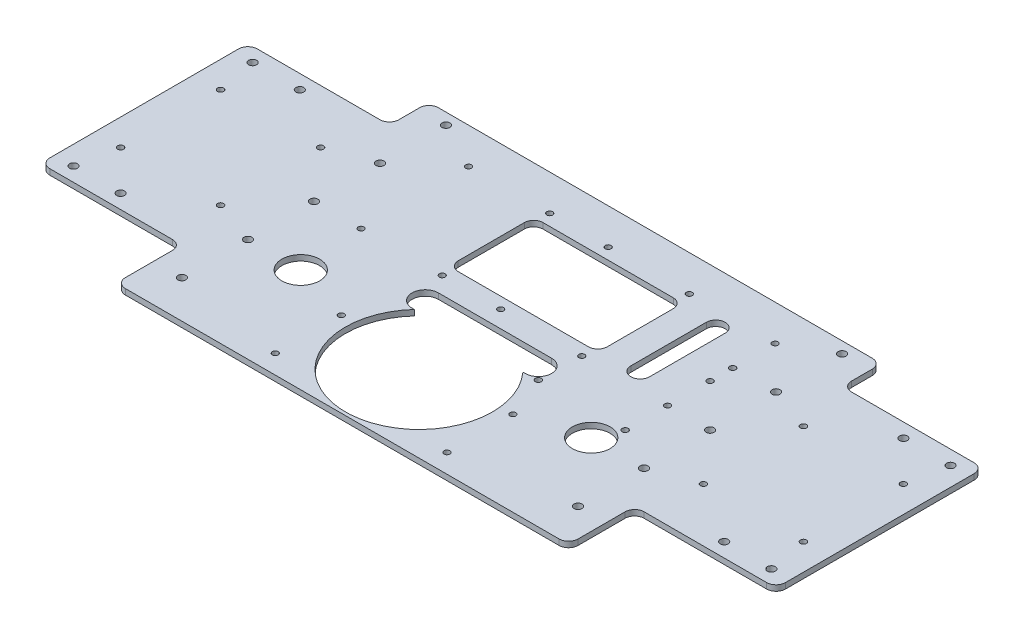
from build123d import *

# Parameters (mm, degrees)
SKETCH_1_W          = 240
SKETCH_1_H          = 166
EXTRUDE_1272_DEPTH  = 3
SKETCH_4_R          = 2.1
SKETCH_4_R_2        = 1.55
CUT_EXTRUDE_3_DEPTH = 251.068459046
SKETCH_5_R          = 1.55
SKETCH_5_R_2        = 10
SKETCH_5_W          = 79
SKETCH_5_H          = 45
CUT_EXTRUDE_4_DEPTH = 251.068459046
SKETCH_6_W          = 75
SKETCH_6_H          = 110
SKETCH_6_R          = 2.1
EXTRUDE_1_DEPTH     = 3
FILLET_1_R          = 5
SKETCH_8_R          = 39
CUT_EXTRUDE_6_DEPTH = 10
CUT_EXTRUDE_START   = -10
SKETCH_9_R          = 1.55
SKETCH_9_R_2        = 1.6
CUT_EXTRUDE_7_DEPTH = 10
SKETCH_10_R         = 1.6
CUT_EXTRUDE_8_DEPTH = 10


with BuildPart() as part:
    # 草图1 → Extrude 1272 (new body)
    with BuildSketch(Plane(origin=(0, 0, 0), x_dir=(1, 0, 0), z_dir=(0, 1, 0))):
        with Locations((31.575924772, -115.871750732)):
            Rectangle(SKETCH_1_W, SKETCH_1_H)
    extrude(amount=EXTRUDE_1272_DEPTH)

    # 草图4 → 切除-拉伸3 (cut, through all)
    with BuildSketch(Plane(origin=(0, 3, 0), x_dir=(1, 0, 0), z_dir=(0, 1, 0))):
        with Locations((-73.424075228, -73.871750732)):
            Circle(SKETCH_4_R)
        with Locations((136.575924772, -178.871750732)):
            Circle(SKETCH_4_R)
        with Locations((-73.424075228, -108.871750732)):
            Circle(SKETCH_4_R)
        with Locations((-73.424075228, -143.871750732)):
            Circle(SKETCH_4_R)
        with Locations((-73.424075228, -178.871750732)):
            Circle(SKETCH_4_R)
        with Locations((136.575924772, -143.871750732)):
            Circle(SKETCH_4_R)
        with Locations((136.575924772, -108.871750732)):
            Circle(SKETCH_4_R)
        with Locations((136.575924772, -73.871750732)):
            Circle(SKETCH_4_R)
        with Locations((-73.424075228, -38.871750732)):
            Circle(SKETCH_4_R)
        with Locations((136.575924772, -38.871750732)):
            Circle(SKETCH_4_R)
        with Locations((77.075924772, -188.871750732)):
            Circle(SKETCH_4_R_2)
        with Locations((-13.924075228, -188.871750732)):
            Circle(SKETCH_4_R_2)
        with Locations((77.075924772, -153.871750732)):
            Circle(SKETCH_4_R_2)
        with Locations((-13.924075228, -153.871750732)):
            Circle(SKETCH_4_R_2)
    extrude(amount=-CUT_EXTRUDE_3_DEPTH, mode=Mode.SUBTRACT)

    # 草图5 → 切除-拉伸4 (cut, through all)
    with BuildSketch(Plane(origin=(0, 3, 0), x_dir=(1, 0, 0), z_dir=(0, 1, 0))):
        with Locations((-5.424075228, -51.871750732)):
            Circle(SKETCH_5_R)
        with Locations((68.575924772, -51.871750732)):
            Circle(SKETCH_5_R)
        with Locations((68.575924772, -108.871750732)):
            Circle(SKETCH_5_R)
        with Locations((-5.424075228, -108.871750732)):
            Circle(SKETCH_5_R)
        with Locations((-45.424075228, -143.871750732)):
            Circle(SKETCH_5_R_2)
        with Locations((108.575924772, -143.871750732)):
            Circle(SKETCH_5_R_2)
        with Locations((31.575924772, -80.371750732)):
            Rectangle(SKETCH_5_W, SKETCH_5_H)
        with BuildLine():
            Line((86.075924772, -100.371750732), (86.075924772, -60.371750732))
            ThreePointArc((86.075924772, -60.371750732), (91.075924772, -55.371750732), (96.075924772, -60.371750732))
            Line((96.075924772, -60.371750732), (96.075924772, -100.371750732))
            ThreePointArc((96.075924772, -100.371750732), (91.075924772, -105.371750732), (86.075924772, -100.371750732))
        make_face()
        with BuildLine():
            Line((1.575924772, -117.871750732), (61.575924772, -117.871750732))
            ThreePointArc((61.575924772, -117.871750732), (68.575924772, -124.871750732), (61.575924772, -131.871750732))
            Line((61.575924772, -131.871750732), (41.575924772, -131.871750732))
            ThreePointArc((41.575924772, -131.871750732), (31.575924772, -141.871750732), (21.575924772, -131.871750732))
            Line((21.575924772, -131.871750732), (1.575924772, -131.871750732))
            ThreePointArc((1.575924772, -131.871750732), (-5.424075228, -124.871750732), (1.575924772, -117.871750732))
        make_face()
    extrude(amount=-CUT_EXTRUDE_4_DEPTH, mode=Mode.SUBTRACT)

    # 草图6 → 凸台-拉伸1 (add)
    # profile 1 of 2: a face of its own
    with BuildSketch(Plane(origin=(0, 0, 0), x_dir=(1, 0, 0), z_dir=(0, 1, 0))):
        with Locations((-125.924075228, -108.871750732)):
            Rectangle(SKETCH_6_W, SKETCH_6_H)
        with Locations((-153.424075228, -61.371750732)):
            Circle(SKETCH_6_R, mode=Mode.SUBTRACT)
        with Locations((-153.424075228, -156.371750732)):
            Circle(SKETCH_6_R, mode=Mode.SUBTRACT)
        with Locations((-128.424075228, -61.371750732)):
            Circle(SKETCH_6_R, mode=Mode.SUBTRACT)
        with Locations((-128.424075228, -156.371750732)):
            Circle(SKETCH_6_R, mode=Mode.SUBTRACT)
    # profile 2 of 2: a face of its own
    with BuildSketch(Plane(origin=(0, 0, 0), x_dir=(1, 0, 0), z_dir=(0, 1, 0))):
        with Locations((189.075924772, -108.871750732)):
            Rectangle(SKETCH_6_W, SKETCH_6_H)
        with Locations((216.575924772, -156.371750732)):
            Circle(SKETCH_6_R, mode=Mode.SUBTRACT)
        with Locations((216.575924772, -61.371750732)):
            Circle(SKETCH_6_R, mode=Mode.SUBTRACT)
        with Locations((191.575924772, -156.371750732)):
            Circle(SKETCH_6_R, mode=Mode.SUBTRACT)
        with Locations((191.575924772, -61.371750732)):
            Circle(SKETCH_6_R, mode=Mode.SUBTRACT)
    extrude(amount=EXTRUDE_1_DEPTH)

    # 圆角1
    fillet_1_edges = [part.edges().sort_by_distance(p)[0] for p in [
        (71.075924772, 1.5, 102.871750732),
        (-7.924075228, 1.5, 102.871750732),
        (-7.924075228, 1.5, 57.871750732),
        (71.075924772, 1.5, 57.871750732),
        (151.575924772, 1.5, 32.871750732),
        (-88.424075228, 1.5, 32.871750732),
        (151.575924772, 1.5, 53.871750732),
        (151.575924772, 1.5, 163.871750732),
        (-88.424075228, 1.5, 163.871750732),
        (-88.424075228, 1.5, 53.871750732),
        (226.575924772, 1.5, 53.871750732),
        (226.575924772, 1.5, 163.871750732),
        (151.575924772, 1.5, 198.871750732),
        (-88.424075228, 1.5, 198.871750732),
        (-163.424075228, 1.5, 53.871750732),
        (-163.424075228, 1.5, 163.871750732),
        (41.575924772, 1.5, 131.871750732),
        (21.575924772, 1.5, 131.871750732),
    ]]
    fillet(fillet_1_edges, radius=FILLET_1_R)

    # 草图8 → 切除-拉伸6 (cut)
    with BuildSketch(Plane(origin=(0, 3, 0), x_dir=(1, 0, 0), z_dir=(0, 1, 0))):
        with Locations((31.575924772, -158.205226673)):
            Circle(SKETCH_8_R)
    extrude(amount=-CUT_EXTRUDE_6_DEPTH, mode=Mode.SUBTRACT)

    # 草图9 → 切除-拉伸7 (cut)
    with BuildSketch(Plane.XZ.offset(CUT_EXTRUDE_START)):
        with Locations((68.575924772, 108.871750732)):
            Circle(SKETCH_9_R)
        with Locations((-48.424075228, 108.871750732)):
            Circle(SKETCH_9_R)
        with Locations((25.575924772, 108.871750732)):
            Circle(SKETCH_9_R)
        with Locations((25.575924772, 51.871750732)):
            Circle(SKETCH_9_R)
        with Locations((-48.424075228, 51.871750732)):
            Circle(SKETCH_9_R)
        with Locations((114.075924772, 51.871750732)):
            Circle(SKETCH_9_R)
        with Locations((114.075924772, 74.371750732)):
            Circle(SKETCH_9_R_2)
        with Locations((114.075924772, 86.371750732)):
            Circle(SKETCH_9_R_2)
        with Locations((114.075924772, 108.871750732)):
            Circle(SKETCH_9_R)
        with Locations((114.075924772, 131.371750732)):
            Circle(SKETCH_9_R_2)
        with Locations((68.075924772, 131.371750732)):
            Circle(SKETCH_9_R_2)
    extrude(amount=CUT_EXTRUDE_7_DEPTH, mode=Mode.SUBTRACT)

    # 草图10 → 切除-拉伸8 (cut)
    with BuildSketch(Plane.XZ):
        with Locations((-149.424075228, 135.371750732)):
            Circle(SKETCH_10_R)
        with Locations((-96.424075228, 135.371750732)):
            Circle(SKETCH_10_R)
        with Locations((-96.424075228, 82.371750732)):
            Circle(SKETCH_10_R)
        with Locations((-149.424075228, 82.371750732)):
            Circle(SKETCH_10_R)
        with Locations((212.575924772, 82.371750732)):
            Circle(SKETCH_10_R)
        with Locations((159.575924772, 82.371750732)):
            Circle(SKETCH_10_R)
        with Locations((159.575924772, 135.371750732)):
            Circle(SKETCH_10_R)
        with Locations((212.575924772, 135.371750732)):
            Circle(SKETCH_10_R)
    extrude(amount=-CUT_EXTRUDE_8_DEPTH, mode=Mode.SUBTRACT)


solid = part.part
